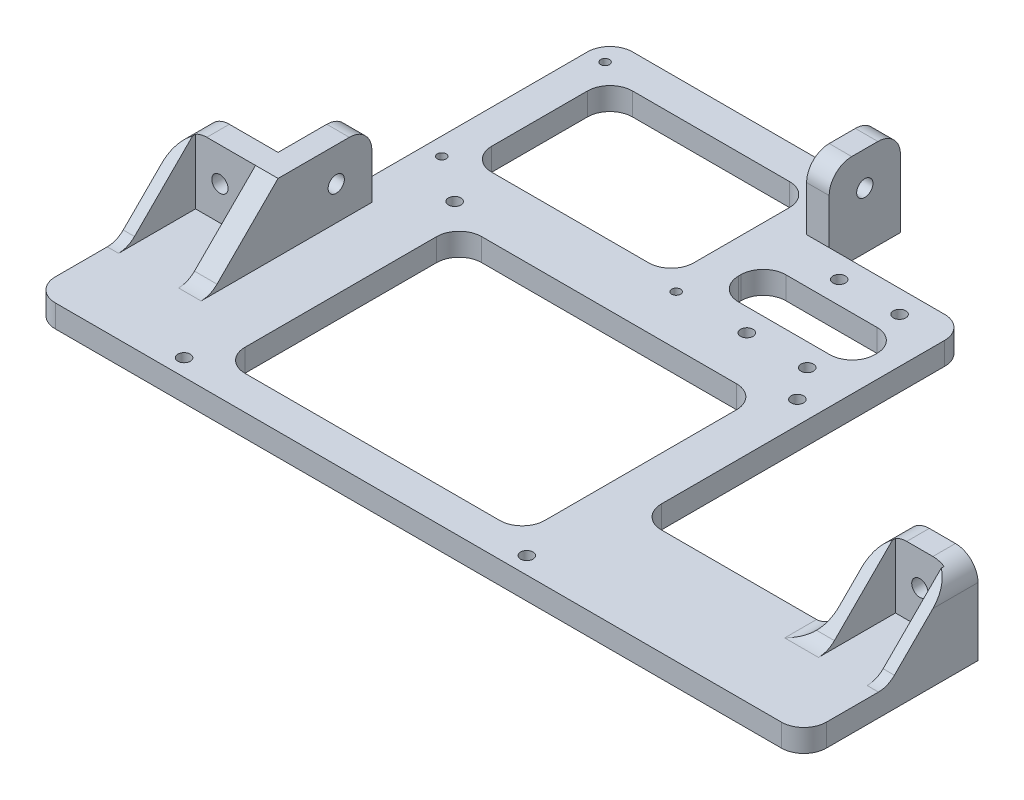
from build123d import *

# Parameters (mm, degrees)
SKETCH2_W            = 217.17
SKETCH2_H            = 49.022
BOSS_EXTRUDE1_DEPTH  = 6.35
SKETCH3_W            = 20.066
SKETCH3_H            = 6.35
BOSS_EXTRUDE2_DEPTH  = 25.4
SKETCH5_W            = 120.65
SKETCH5_H            = 73.406
BOSS_EXTRUDE3_DEPTH  = 6.35
SKETCH6_W            = 6.35
SKETCH6_H            = 26.416
BOSS_EXTRUDE4_DEPTH  = 19.05
SKETCH7_R            = 2.286
CUT_EXTRUDE1_DEPTH   = 134.507689146
SKETCH8_R            = 2.286
CUT_EXTRUDE2_DEPTH   = 222.54657683
SKETCH9_W            = 56.388
SKETCH9_H            = 19.05
CUT_EXTRUDE3_DEPTH   = 148.44946122
SKETCH11_W           = 81.788
SKETCH11_H           = 20.066
BOSS_EXTRUDE5_DEPTH  = 6.35
SKETCH12_W           = 6.35
SKETCH12_H           = 20.066
BOSS_EXTRUDE6_DEPTH  = 25.4
SKETCH16_R           = 1.25
SKETCH16_R_2         = 1.75
SKETCH16_W           = 56.889130435
SKETCH16_H           = 39.65
SKETCH16_W_2         = 84.455
SKETCH16_H_2         = 66.675
SKETCH16_W_3         = 38.360869565
SKETCH16_H_3         = 13.3
CUT_EXTRUDE6_DEPTH   = 162.473195961
BOSS_EXTRUDE8_DEPTH  = 3.175
BOSS_EXTRUDE9_DEPTH  = 3.175
BOSS_EXTRUDE10_DEPTH = 3.175
BOSS_EXTRUDE11_DEPTH = 6.35
FILLET1_R            = 6.35
SKETCH21_R           = 2.286
CUT_EXTRUDE7_DEPTH   = 172.370253676
FILLET2_R            = 6.35


# Some blends are built 0.0001 mm under size
with BuildPart() as part:
    # Sketch2 → Boss-Extrude1 (new body)
    with BuildSketch(Plane(origin=(0, 0, 0), x_dir=(1, 0, 0), z_dir=(0, 1, 0))):
        Rectangle(SKETCH2_W, SKETCH2_H)
    extrude(amount=BOSS_EXTRUDE1_DEPTH)

    # Sketch3 → Boss-Extrude2 (add)
    with BuildSketch(Plane.XZ):
        with Locations((98.552, -21.336)):
            Rectangle(SKETCH3_W, SKETCH3_H)
        with Locations((-98.552, -21.336)):
            Rectangle(SKETCH3_W, SKETCH3_H)
    extrude(amount=-BOSS_EXTRUDE2_DEPTH)

    # Sketch5 → Boss-Extrude3 (add)
    with BuildSketch(Plane(origin=(0, 6.35, 0), x_dir=(1, 0, 0), z_dir=(0, 1, 0))):
        with Locations((-28.194, 61.214)):
            Rectangle(SKETCH5_W, SKETCH5_H)
    extrude(amount=-BOSS_EXTRUDE3_DEPTH)

    # Sketch6 → Boss-Extrude4 (add)
    with BuildSketch(Plane(origin=(0, 6.35, 0), x_dir=(1, 0, 0), z_dir=(0, 1, 0))):
        with Locations((-85.344, 31.369)):
            Rectangle(SKETCH6_W, SKETCH6_H)
    extrude(amount=BOSS_EXTRUDE4_DEPTH)

    # Sketch7 → Cut-Extrude1 (cut, through all)
    with BuildSketch(Plane(origin=(0, 0, -24.511), x_dir=(-1, 0, 0), z_dir=(0, 0, -1))):
        with Locations((-98.552, 15.875)):
            Circle(SKETCH7_R)
        with Locations((98.552, 15.875)):
            Circle(SKETCH7_R)
    extrude(amount=-CUT_EXTRUDE1_DEPTH, mode=Mode.SUBTRACT)

    # Sketch8 → Cut-Extrude2 (cut, through all)
    with BuildSketch(Plane.ZY.offset(88.519)):
        with Locations((-34.544, 15.875)):
            Circle(SKETCH8_R)
    extrude(amount=-CUT_EXTRUDE2_DEPTH, mode=Mode.SUBTRACT)

    # Sketch9 → Cut-Extrude3 (cut, through all)
    with BuildSketch(Plane(origin=(0, 6.35, 0), x_dir=(1, 0, 0), z_dir=(0, 1, 0))):
        with Locations((60.325, 14.986)):
            Rectangle(SKETCH9_W, SKETCH9_H)
    extrude(amount=-CUT_EXTRUDE3_DEPTH, mode=Mode.SUBTRACT)

    # Sketch11 → Boss-Extrude5 (add)
    with BuildSketch(Plane(origin=(0, 6.35, 0), x_dir=(1, 0, 0), z_dir=(0, 1, 0))):
        with Locations((-47.625, 107.95)):
            Rectangle(SKETCH11_W, SKETCH11_H)
    extrude(amount=-BOSS_EXTRUDE5_DEPTH)

    # Sketch12 → Boss-Extrude6 (add)
    with BuildSketch(Plane.XZ):
        with Locations((-9.906, -107.95)):
            Rectangle(SKETCH12_W, SKETCH12_H)
    extrude(amount=-BOSS_EXTRUDE6_DEPTH)

    # Sketch16 → Cut-Extrude6 (cut, through all)
    with BuildSketch(Plane(origin=(0, 6.35, 0), x_dir=(1, 0, 0), z_dir=(0, 1, 0))):
        with Locations(Location((-17.549434783, 111.633, 0), (0, 0, 270))):
            Circle(SKETCH16_R)
        with Locations(Location((-17.549434783, 65.633, 0), (0, 0, 270))):
            Circle(SKETCH16_R)
        with Locations(Location((-83.549434783, 65.633, 0), (0, 0, 270))):
            Circle(SKETCH16_R)
        with Locations(Location((-83.549434783, 111.633, 0), (0, 0, 270))):
            Circle(SKETCH16_R)
        with Locations(Location((-70.739, 56.4515, 0), (0, 0, 270))):
            Circle(SKETCH16_R_2)
        with Locations(Location((-70.739, -19.7485, 0), (0, 0, 270))):
            Circle(SKETCH16_R_2)
        with Locations(Location((25.781, -19.7485, 0), (0, 0, 270))):
            Circle(SKETCH16_R_2)
        with Locations(Location((25.781, 56.4515, 0), (0, 0, 270))):
            Circle(SKETCH16_R_2)
        with Locations(Location((19.431, 91.567, 0), (0, 0, 270))):
            Circle(SKETCH16_R_2)
        with Locations(Location((19.431, 65.567, 0), (0, 0, 270))):
            Circle(SKETCH16_R_2)
        with Locations(Location((2.431, 65.567, 0), (0, 0, 270))):
            Circle(SKETCH16_R_2)
        with Locations(Location((2.431, 91.567, 0), (0, 0, 270))):
            Circle(SKETCH16_R_2)
        with Locations((-50.549434783, 88.633)):
            Rectangle(SKETCH16_W, SKETCH16_H)
        with Locations((-22.479, 18.3515)):
            Rectangle(SKETCH16_W_2, SKETCH16_H_2)
        with Locations((6.600565218, 78.567)):
            Rectangle(SKETCH16_W_3, SKETCH16_H_3)
    extrude(amount=-CUT_EXTRUDE6_DEPTH, mode=Mode.SUBTRACT)

    # Sketch17 → Boss-Extrude8 (add)
    with BuildSketch(Plane.ZY.offset(108.585)):
        Polygon((-18.161, 25.4), (-18.161, 6.35), (0.889, 6.35), align=None)
    extrude(amount=-BOSS_EXTRUDE8_DEPTH)

    # Sketch18 → Boss-Extrude9 (add)
    with BuildSketch(Plane(origin=(108.585, 0, 0), x_dir=(0, 0, -1), z_dir=(1, 0, 0))):
        Polygon((18.161, 25.4), (-0.889, 6.35), (18.161, 6.35), align=None)
    extrude(amount=-BOSS_EXTRUDE9_DEPTH)

    # Sketch19 → Boss-Extrude10 (add)
    with BuildSketch(Plane.ZY.offset(-88.519)):
        Polygon((-18.161, 25.4), (-18.161, 6.35), (0.889, 6.35), align=None)
    extrude(amount=-BOSS_EXTRUDE10_DEPTH)

    # Sketch20 → Boss-Extrude11 (add)
    with BuildSketch(Plane(origin=(-82.169, 0, 0), x_dir=(0, 0, -1), z_dir=(1, 0, 0))):
        Polygon((18.161, 25.4), (-0.889, 6.35), (18.161, 6.35), align=None)
    extrude(amount=-BOSS_EXTRUDE11_DEPTH)

    # Fillet1
    fillet1_edges = [part.edges().sort_by_distance(p)[0] for p in [
        (88.519, 3.175, -5.461),
        (32.131, 3.175, -5.461),
        (-88.519, 3.175, -117.983),
        (-22.104869565, 3.175, -108.458),
        (-22.104869565, 3.175, -68.808),
        (-78.994, 3.175, -68.808),
        (-78.994, 3.175, -108.458),
        (25.781, 3.175, -85.217),
        (25.781, 3.175, -71.917),
        (-12.579869565, 3.175, -71.917),
        (-12.579869565, 3.175, -85.217),
        (19.7485, 3.175, -51.689),
        (19.7485, 3.175, 14.986),
        (-64.7065, 3.175, 14.986),
        (-64.7065, 3.175, -51.689),
        (32.131, 3.175, -97.917),
        (108.585, 3.175, 24.511),
        (-108.585, 3.175, 24.511),
    ]]
    fillet(fillet1_edges, radius=FILLET1_R)

    # Sketch21 → Cut-Extrude7 (cut, through all)
    with BuildSketch(Plane.ZY.offset(13.081)):
        with Locations((-107.95, 15.875)):
            Circle(SKETCH21_R)
    extrude(amount=-CUT_EXTRUDE7_DEPTH, mode=Mode.SUBTRACT)

    # Fillet2
    fillet2_edges = [part.edges().sort_by_distance(p)[0] for p in [
        (88.519, 6.35, -5.461),
        (106.9975, 6.35, 0.889),
        (90.1065, 6.35, 0.889),
        (-85.344, 6.35, 0.889),
        (-106.9975, 6.35, 0.889),
    ]]
    fillet(fillet2_edges, radius=FILLET2_R - 0.0001)  # a hair under: the kernel refuses the full size
    # the kernel refuses this fillet: 6.35 mm, written as the material it takes off along each edge
    with BuildSketch(Plane(origin=(108.585, 25.4, -2.286), x_dir=(0, -1, 0), z_dir=(0, 0, -1)), Plane(origin=(-66.294, 25.4, -44.577), x_dir=(0, -1, 0), z_dir=(-1, 0, 0))) as fillet2_2_piece_1:
        with BuildLine():
            CenterArc((FILLET2_R, FILLET2_R), FILLET2_R, 180, 90)
            Line((0, FILLET2_R), (-FILLET2_R * 0.02, FILLET2_R))
            Line((-FILLET2_R * 0.02, FILLET2_R), (-FILLET2_R * 0.02, -FILLET2_R * 0.02))
            Line((-FILLET2_R * 0.02, -FILLET2_R * 0.02), (FILLET2_R, -FILLET2_R * 0.02))
            Line((FILLET2_R, -FILLET2_R * 0.02), (FILLET2_R, 0))
        make_face()
    extrude(amount=38.1, mode=Mode.SUBTRACT)
    with BuildSketch(Plane(origin=(88.519, 25.4, -40.386), x_dir=(1, 0, 0), z_dir=(0, 0, 1)), Plane(origin=(-28.956, 25.4, -117.983), x_dir=(0, -1, 0), z_dir=(1, 0, 0)), Plane(origin=(-108.585, 25.4, -2.286), x_dir=(0, -1, 0), z_dir=(0, 0, -1)), Plane(origin=(9.144, 25.4, -97.917), x_dir=(0, -1, 0), z_dir=(-1, 0, 0))) as fillet2_2_piece_2:
        with BuildLine():
            CenterArc((FILLET2_R, -FILLET2_R), FILLET2_R, 90, 90)
            Line((0, -FILLET2_R), (-FILLET2_R * 0.02, -FILLET2_R))
            Line((-FILLET2_R * 0.02, -FILLET2_R), (-FILLET2_R * 0.02, FILLET2_R * 0.02))
            Line((-FILLET2_R * 0.02, FILLET2_R * 0.02), (FILLET2_R, FILLET2_R * 0.02))
            Line((FILLET2_R, FILLET2_R * 0.02), (FILLET2_R, 0))
        make_face()
    extrude(amount=38.1, mode=Mode.SUBTRACT)


solid = part.part
